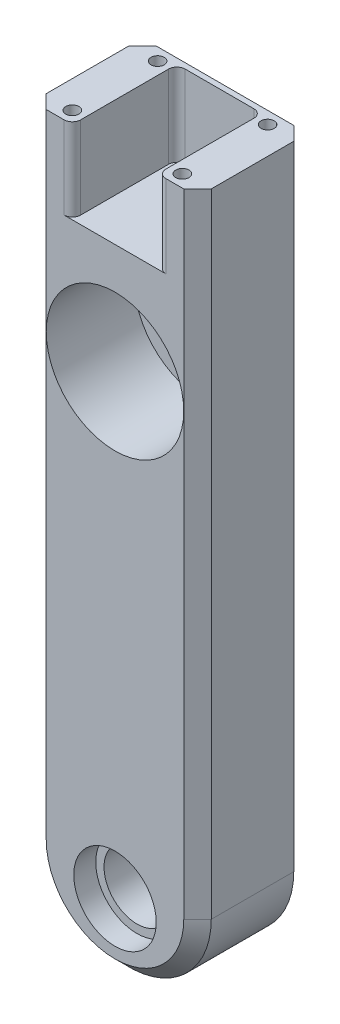
from build123d import *

# Parameters (mm, degrees)
SKETCH1_R           = 4
SKETCH1_R_2         = 7.5
BOSS_EXTRUDE1_DEPTH = 10
SKETCH2_R           = 7.5
SKETCH2_R_2         = 6
BOSS_EXTRUDE2_DEPTH = 6
CUT_EXTRUDE2_DEPTH  = 6
SKETCH4_R           = 12.5
CUT_EXTRUDE1_DEPTH  = 16
SKETCH8_W           = 7.25
SKETCH8_H           = 20
SKETCH8_R           = 1.2
BOSS_EXTRUDE3_DEPTH = 15
SKETCH10_W          = 15.5
SKETCH10_H          = 1
BOSS_EXTRUDE4_DEPTH = 15
FILLET1_R           = 1.5
CHAMFER1_SIZE       = 2.5


with BuildPart() as part:
    # Sketch1 → Boss-Extrude1 (new, symmetric)
    with BuildSketch(Plane.XY):
        with BuildLine():
            Line((-15, -80), (-15, 20))
            Line((-15, 20), (15, 20))
            Line((15, 20), (15, -80))
            ThreePointArc((15, -80), (0, -95), (-15, -80))
        make_face()
        Circle(SKETCH1_R, mode=Mode.SUBTRACT)
        with Locations((0, -83)):
            Circle(SKETCH1_R_2, mode=Mode.SUBTRACT)
    extrude(amount=BOSS_EXTRUDE1_DEPTH, both=True)

    # Sketch2 → Boss-Extrude2 (add, symmetric)
    with BuildSketch(Plane.XY):
        with Locations((0, -83)):
            Circle(SKETCH2_R)
        with Locations((0, -83)):
            Circle(SKETCH2_R_2, mode=Mode.SUBTRACT)
    extrude(amount=BOSS_EXTRUDE2_DEPTH, both=True)

    # Sketch11 → Cut-Extrude2 (cut)
    with BuildSketch(Plane(origin=(0, 0, -10), x_dir=(-1, 0, 0), z_dir=(0, 0, -1))):
        Polygon((0, 6), (-5.196152423, 3), (-5.196152423, -3), (0, -6), (5.196152423, -3), (5.196152423, 3), align=None)
    extrude(amount=-CUT_EXTRUDE2_DEPTH, mode=Mode.SUBTRACT)

    # Sketch4 → Cut-Extrude1 (cut)
    with BuildSketch(Plane(origin=(0, 0, 10), x_dir=(-1, 0, 0), z_dir=(0, 0, -1))):
        Circle(SKETCH4_R)
    extrude(amount=CUT_EXTRUDE1_DEPTH, mode=Mode.SUBTRACT)

    # Sketch8 → Boss-Extrude3 (add)
    # profile 1 of 2: a face of its own
    with BuildSketch(Plane(origin=(0, 20, 0), x_dir=(1, 0, 0), z_dir=(0, 1, 0))):
        with Locations((-11.375, 0)):
            Rectangle(SKETCH8_W, SKETCH8_H)
        with Locations(Location((-10, -7.75, 0), (0, 0, 270))):
            Circle(SKETCH8_R, mode=Mode.SUBTRACT)
        with Locations(Location((-10, 7.75, 0), (0, 0, 90))):
            Circle(SKETCH8_R, mode=Mode.SUBTRACT)
    # profile 2 of 2: a face of its own
    with BuildSketch(Plane(origin=(0, 20, 0), x_dir=(1, 0, 0), z_dir=(0, 1, 0))):
        with Locations((11.375, 0)):
            Rectangle(SKETCH8_W, SKETCH8_H)
        with Locations(Location((10, -7.75, 0), (0, 0, 90))):
            Circle(SKETCH8_R, mode=Mode.SUBTRACT)
        with Locations(Location((10, 7.75, 0), (0, 0, 270))):
            Circle(SKETCH8_R, mode=Mode.SUBTRACT)
    extrude(amount=BOSS_EXTRUDE3_DEPTH)

    # Sketch10 → Boss-Extrude4 (add)
    with BuildSketch(Plane(origin=(0, 20, 0), x_dir=(1, 0, 0), z_dir=(0, 1, 0))):
        with Locations((0, 9.5)):
            Rectangle(SKETCH10_W, SKETCH10_H)
    extrude(amount=BOSS_EXTRUDE4_DEPTH)

    # Fillet1
    fillet1_edges = [part.edges().sort_by_distance(p)[0] for p in [
        (-7.75, 27.5, -9),
        (7.75, 27.5, -9),
        (-7.75, 27.5, 10),
        (7.75, 27.5, 10),
    ]]
    fillet(fillet1_edges, radius=FILLET1_R)

    # Chamfer1
    chamfer1_edges = [part.edges().sort_by_distance(p)[0] for p in [
        (-15, -22.5, 10),
        (0, -95, 10),
        (15, -22.5, 10),
        (15, -22.5, -10),
        (0, -95, -10),
        (-15, -22.5, -10),
    ]]
    chamfer(chamfer1_edges, length=CHAMFER1_SIZE - 0.0001)  # a hair under: the kernel refuses the full size


solid = part.part
